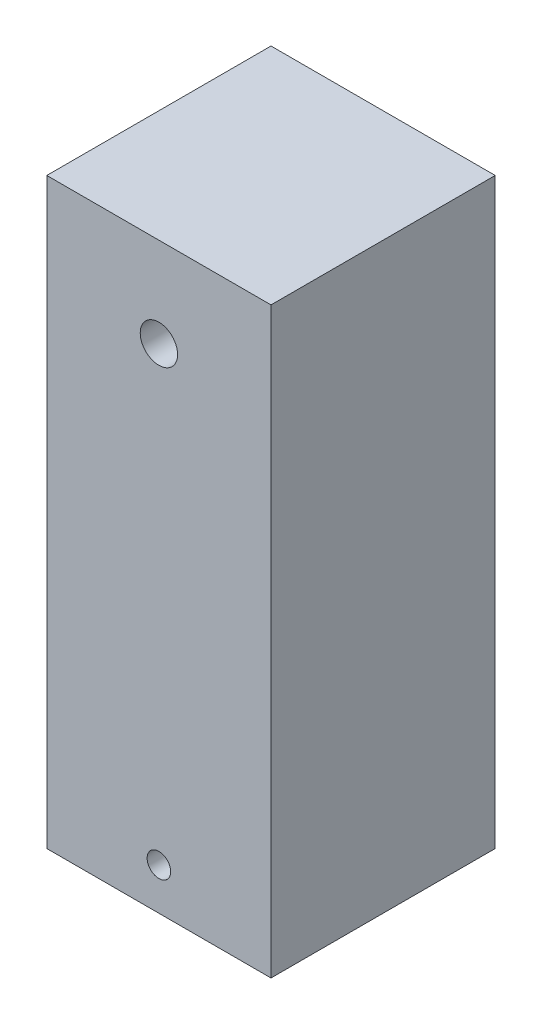
from build123d import *

# Parameters (mm, degrees)
SKETCH1_W           = 19.05
SKETCH1_H           = 49.53
SKETCH1_R           = 1.5875
BOSS_EXTRUDE1_DEPTH = 19.05
SKETCH3_R           = 1
CUT_EXTRUDE2_DEPTH  = 33.66394572


with BuildPart() as part:
    # Sketch1 → Boss-Extrude1 (new body)
    with BuildSketch(Plane.XY):
        Rectangle(SKETCH1_W, SKETCH1_H)
        with Locations((0, 17.145)):
            Circle(SKETCH1_R, mode=Mode.SUBTRACT)
    extrude(amount=BOSS_EXTRUDE1_DEPTH)

    # Sketch3 → Cut-Extrude2 (cut, through all)
    with BuildSketch(Plane(origin=(0, 0, 0), x_dir=(-1, 0, 0), z_dir=(0, 0, -1))):
        with Locations((0, -21.209)):
            Circle(SKETCH3_R)
    extrude(amount=-CUT_EXTRUDE2_DEPTH, mode=Mode.SUBTRACT)


solid = part.part
